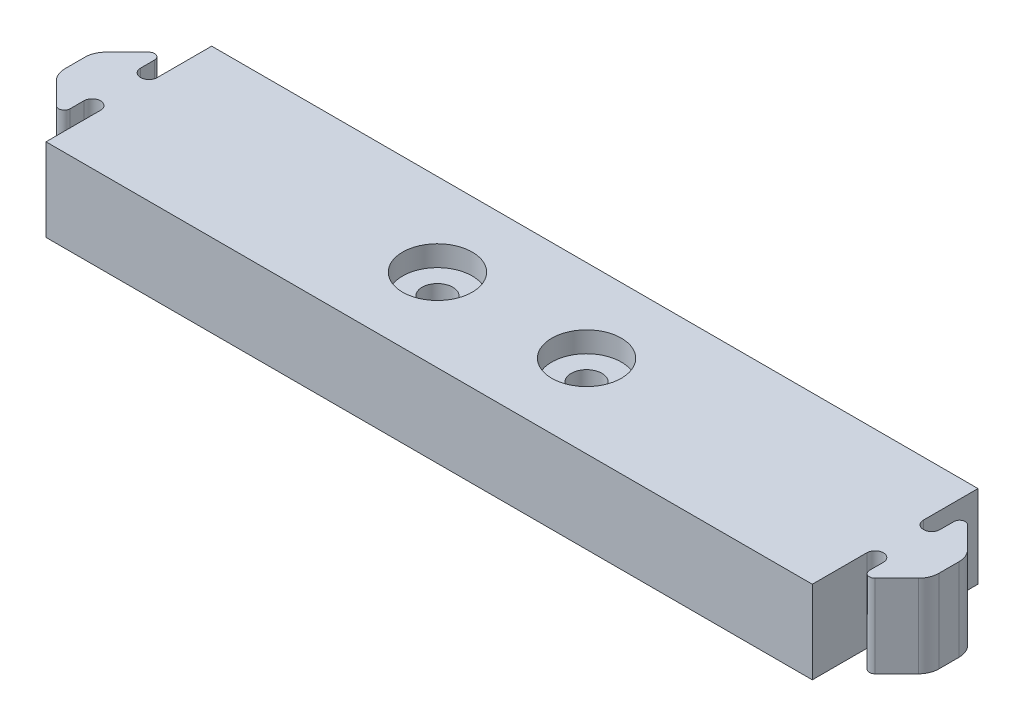
from build123d import *

# Parameters (mm, degrees)
SKETCH1_W           = 117.475
SKETCH1_H           = 25.4
BOSS_EXTRUDE1_DEPTH = 12.7
BOSS_EXTRUDE7_DEPTH = 12.7
SKETCH3_R           = 2.3495
CUT_EXTRUDE1_DEPTH  = 129.893542251
SKETCH11_R          = 5.08
CUT_EXTRUDE2_DEPTH  = 3.81
SKETCH14_R          = 5.334
CUT_EXTRUDE3_DEPTH  = 3.175
SKETCH13_R          = 5.334
CUT_EXTRUDE4_DEPTH  = 3.175


with BuildPart() as part:
    # Sketch1 → Boss-Extrude1 (new body)
    with BuildSketch(Plane(origin=(0, 0, 0), x_dir=(1, 0, 0), z_dir=(0, 1, 0))):
        with Locations((-58.7375, -12.7)):
            Rectangle(SKETCH1_W, SKETCH1_H)
    extrude(amount=BOSS_EXTRUDE1_DEPTH)

    # Sketch10 → Boss-Extrude7 (add)
    with BuildSketch(Plane(origin=(0, 12.7, 0), x_dir=(1, 0, 0), z_dir=(0, 1, 0))):
        with BuildLine():
            Line((0, -12.7), (0, -8.3566))
            ThreePointArc((0, -8.3566), (1.27, -9.6266), (2.54, -8.3566))
            Line((2.54, -8.3566), (2.54, -6.223))
            ThreePointArc((2.54, -6.223), (3.073114588, -5.425137636), (4.014257416, -5.612342584))
            Line((4.014257416, -5.612342584), (7.336952181, -8.935037349))
            ThreePointArc((7.336952181, -8.935037349), (8.017998618, -9.969860776), (8.2511937, -11.186538149))
            Line((8.2511937, -11.186538149), (8.2511937, -12.7))
            Line((8.2511937, -12.7), (0, -12.7))
        make_face()
        with BuildLine():
            Line((-117.475, -12.7), (-117.475, -8.3566))
            ThreePointArc((-117.475, -8.3566), (-118.745, -9.6266), (-120.015, -8.3566))
            Line((-120.015, -8.3566), (-120.015, -6.223))
            ThreePointArc((-120.015, -6.223), (-120.548114588, -5.425137636), (-121.489257416, -5.612342584))
            Line((-121.489257416, -5.612342584), (-124.811952181, -8.935037349))
            ThreePointArc((-124.811952181, -8.935037349), (-125.492998618, -9.969860776), (-125.7261937, -11.186538149))
            Line((-125.7261937, -11.186538149), (-125.7261937, -12.7))
            Line((-125.7261937, -12.7), (-117.475, -12.7))
        make_face()
    boss_extrude7 = extrude(amount=-BOSS_EXTRUDE7_DEPTH)

    # Mirror1: Boss-Extrude7 across plane
    add(boss_extrude7.mirror(Plane(origin=(8.2511937, 0, 12.7), x_dir=(1, 0, 0), z_dir=(0, 0, 1))))

    # Sketch3 → Cut-Extrude1 (cut, through all)
    with BuildSketch(Plane(origin=(0, 12.7, 0), x_dir=(1, 0, 0), z_dir=(0, 1, 0))):
        with Locations((-47.3075, -12.7)):
            Circle(SKETCH3_R)
        with Locations((-70.1675, -12.7)):
            Circle(SKETCH3_R)
    extrude(amount=-CUT_EXTRUDE1_DEPTH, mode=Mode.SUBTRACT)

    # Sketch11 → Cut-Extrude2 (cut)
    with BuildSketch(Plane(origin=(0, 0, 0), x_dir=(-1, 0, 0), z_dir=(0, -1, 0))):
        with Locations((70.1675, -12.7)):
            Circle(SKETCH11_R)
        with Locations((47.3075, -12.7)):
            Circle(SKETCH11_R)
    extrude(amount=-CUT_EXTRUDE2_DEPTH, mode=Mode.SUBTRACT)

    # Sketch14 → Cut-Extrude3 (cut)
    with BuildSketch(Plane(origin=(0, 12.7, 0), x_dir=(1, 0, 0), z_dir=(0, 1, 0))):
        with Locations((-47.3075, -12.7)):
            Circle(SKETCH14_R)
    extrude(amount=-CUT_EXTRUDE3_DEPTH, mode=Mode.SUBTRACT)

    # Sketch13 → Cut-Extrude4 (cut)
    with BuildSketch(Plane(origin=(0, 12.7, 0), x_dir=(1, 0, 0), z_dir=(0, 1, 0))):
        with Locations((-70.1675, -12.7)):
            Circle(SKETCH13_R)
    extrude(amount=-CUT_EXTRUDE4_DEPTH, mode=Mode.SUBTRACT)


solid = part.part
